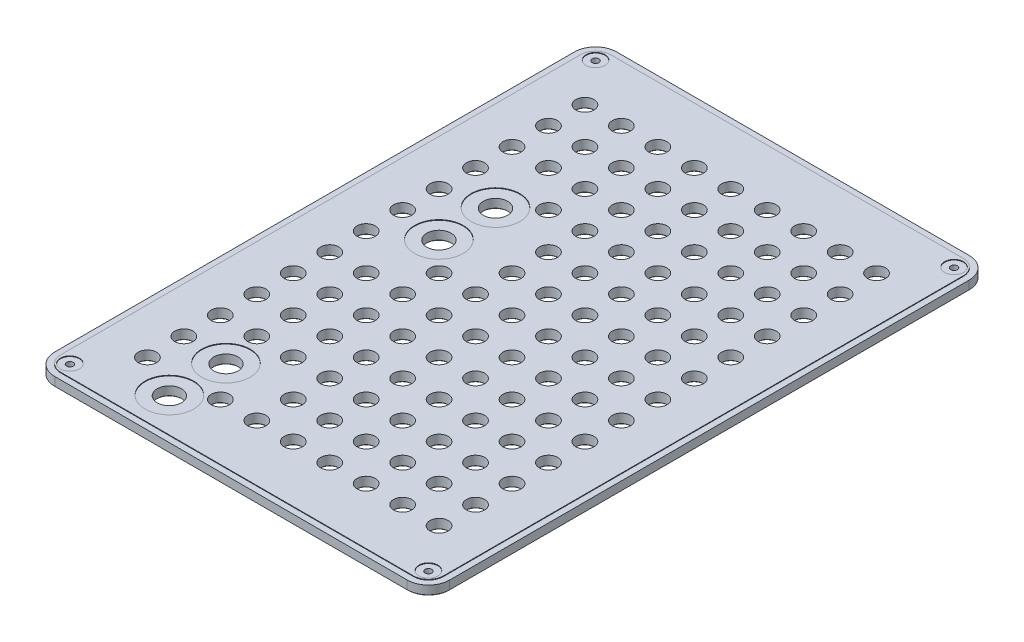
from build123d import *

# Parameters (mm, degrees)
SKETCH_1_W          = 130
SKETCH_1_H          = 185
EXTRUDE_1_DEPTH     = 3
FILLET_1_R          = 7
SKETCH_2_R          = 1.1
CUT_EXTRUDE_1_DEPTH = 3
SKETCH_3_R          = 4
CUT_EXTRUDE_2_DEPTH = 3
SKETCH_5_R          = 8
SKETCH_5_R_2        = 3.1
EXTRUDE_2_DEPTH     = 0.2
SKETCH_4_R          = 3
CUT_EXTRUDE_3_DEPTH = 10
OTHER_1_OUTLINE_R   = 3
OTHER_1_DEPTH       = 3.2
CHAMFER_1_SIZE      = 0.2


# Read off the part's stored shape, not the designer's step: 填充阵列1
with BuildPart() as part:
    # 草图1 → 凸台-拉伸1 (new body)
    with BuildSketch(Plane(origin=(0, 0, 0), x_dir=(1, 0, 0), z_dir=(0, 1, 0))):
        with Locations((65, 92.5)):
            Rectangle(SKETCH_1_W, SKETCH_1_H)
    extrude(amount=EXTRUDE_1_DEPTH)

    # 圆角1
    fillet_1_edges = [part.edges().sort_by_distance(p)[0] for p in [
        (0, 1.5, -185),
        (130, 1.5, -185),
        (130, 1.5, 0),
        (0, 1.5, 0),
    ]]
    fillet(fillet_1_edges, radius=FILLET_1_R)

    # 草图2 → 切除-拉伸1 (cut)
    with BuildSketch(Plane(origin=(0, 3, 0), x_dir=(1, 0, 0), z_dir=(0, 1, 0))):
        with Locations(Location((6, 6, 0), (0, 0, 270))):
            Circle(SKETCH_2_R)
        with Locations(Location((124, 6, 0), (0, 0, 270))):
            Circle(SKETCH_2_R)
        with Locations(Location((124, 179, 0), (0, 0, 270))):
            Circle(SKETCH_2_R)
        with Locations(Location((6, 179, 0), (0, 0, 270))):
            Circle(SKETCH_2_R)
    extrude(amount=-CUT_EXTRUDE_1_DEPTH, mode=Mode.SUBTRACT)

    # 草图3 → 切除-拉伸2 (cut)
    with BuildSketch(Plane(origin=(0, 0, 0), x_dir=(-1, 0, 0), z_dir=(0, -1, 0))):
        with Locations(Location((-31.575736126, 31.770840885, 0), (0, 0, 90))):
            Circle(SKETCH_3_R)
        with Locations(Location((-31.35287608, 13.373728871, 0), (0, 0, 90))):
            Circle(SKETCH_3_R)
        with Locations(Location((-31.575736126, 120.485598314, 0), (0, 0, 90))):
            Circle(SKETCH_3_R)
        with Locations(Location((-31.35287608, 102.0884863, 0), (0, 0, 90))):
            Circle(SKETCH_3_R)
    extrude(amount=-CUT_EXTRUDE_2_DEPTH, mode=Mode.SUBTRACT)

    # 草图5 → 凸台-拉伸2 (add)
    with BuildSketch(Plane(origin=(0, 3, 0), x_dir=(1, 0, 0), z_dir=(0, 1, 0))):
        with BuildLine():
            Line((128, 7), (128, 178))
            ThreePointArc((128, 178), (126.535533906, 181.535533906), (123, 183))
            Line((123, 183), (7, 183))
            ThreePointArc((7, 183), (3.464466094, 181.535533906), (2, 178))
            Line((2, 178), (2, 7))
            ThreePointArc((2, 7), (3.464466094, 3.464466094), (7, 2))
            Line((7, 2), (123, 2))
            ThreePointArc((123, 2), (126.535533906, 3.464466094), (128, 7))
        make_face()
        with Locations(Location((31.575736126, 120.485598314, 0), (0, 0, 270))):
            Circle(SKETCH_5_R, mode=Mode.SUBTRACT)
        with Locations(Location((31.575736126, 31.770840885, 0), (0, 0, 270))):
            Circle(SKETCH_5_R, mode=Mode.SUBTRACT)
        with Locations(Location((31.35287608, 102.0884863, 0), (0, 0, 270))):
            Circle(SKETCH_5_R, mode=Mode.SUBTRACT)
        with Locations(Location((31.35287608, 13.373728871, 0), (0, 0, 270))):
            Circle(SKETCH_5_R, mode=Mode.SUBTRACT)
        with Locations(Location((6, 179, 0), (0, 0, 270))):
            Circle(SKETCH_5_R_2, mode=Mode.SUBTRACT)
        with Locations(Location((124, 179, 0), (0, 0, 270))):
            Circle(SKETCH_5_R_2, mode=Mode.SUBTRACT)
        with Locations(Location((6, 6, 0), (0, 0, 270))):
            Circle(SKETCH_5_R_2, mode=Mode.SUBTRACT)
        with Locations(Location((124, 6, 0), (0, 0, 270))):
            Circle(SKETCH_5_R_2, mode=Mode.SUBTRACT)
    extrude(amount=EXTRUDE_2_DEPTH)

    # 草图4 → 切除-拉伸3 (cut)
    with BuildSketch(Plane(origin=(0, 3.2, 0), x_dir=(1, 0, 0), z_dir=(0, 1, 0))):
        with Locations(Location((65, 92.5, 0), (0, 0, 270))):
            Circle(SKETCH_4_R)
    extrude(amount=-CUT_EXTRUDE_3_DEPTH, mode=Mode.SUBTRACT)

    # 填充阵列1 outline → 填充阵列1 (cut)
    with BuildSketch(Plane(origin=(0, 0, 0), x_dir=(1, 0, 0), z_dir=(0, 1, 0))):
        with Locations((113, 20.5)):
            Circle(OTHER_1_OUTLINE_R)
        with Locations((29, 56.5)):
            Circle(OTHER_1_OUTLINE_R)
        with Locations((29, 44.5)):
            Circle(OTHER_1_OUTLINE_R)
        with Locations((41, 164.5)):
            Circle(OTHER_1_OUTLINE_R)
        with Locations((41, 152.5)):
            Circle(OTHER_1_OUTLINE_R)
        with Locations((41, 140.5)):
            Circle(OTHER_1_OUTLINE_R)
        with Locations((41, 128.5)):
            Circle(OTHER_1_OUTLINE_R)
        with Locations((41, 92.5)):
            Circle(OTHER_1_OUTLINE_R)
        with Locations((41, 80.5)):
            Circle(OTHER_1_OUTLINE_R)
        with Locations((29, 164.5)):
            Circle(OTHER_1_OUTLINE_R)
        with Locations((17, 20.5)):
            Circle(OTHER_1_OUTLINE_R)
        with Locations((17, 32.5)):
            Circle(OTHER_1_OUTLINE_R)
        with Locations((17, 44.5)):
            Circle(OTHER_1_OUTLINE_R)
        with Locations((29, 152.5)):
            Circle(OTHER_1_OUTLINE_R)
        with Locations((29, 140.5)):
            Circle(OTHER_1_OUTLINE_R)
        with Locations((29, 80.5)):
            Circle(OTHER_1_OUTLINE_R)
        with Locations((29, 68.5)):
            Circle(OTHER_1_OUTLINE_R)
        with Locations((53, 32.5)):
            Circle(OTHER_1_OUTLINE_R)
        with Locations((53, 44.5)):
            Circle(OTHER_1_OUTLINE_R)
        with Locations((53, 56.5)):
            Circle(OTHER_1_OUTLINE_R)
        with Locations((53, 68.5)):
            Circle(OTHER_1_OUTLINE_R)
        with Locations((53, 80.5)):
            Circle(OTHER_1_OUTLINE_R)
        with Locations((53, 92.5)):
            Circle(OTHER_1_OUTLINE_R)
        with Locations((53, 104.5)):
            Circle(OTHER_1_OUTLINE_R)
        with Locations((53, 116.5)):
            Circle(OTHER_1_OUTLINE_R)
        with Locations((53, 128.5)):
            Circle(OTHER_1_OUTLINE_R)
        with Locations((53, 140.5)):
            Circle(OTHER_1_OUTLINE_R)
        with Locations((53, 152.5)):
            Circle(OTHER_1_OUTLINE_R)
        with Locations((53, 164.5)):
            Circle(OTHER_1_OUTLINE_R)
        with Locations((41, 20.5)):
            Circle(OTHER_1_OUTLINE_R)
        with Locations((41, 44.5)):
            Circle(OTHER_1_OUTLINE_R)
        with Locations((41, 56.5)):
            Circle(OTHER_1_OUTLINE_R)
        with Locations((41, 68.5)):
            Circle(OTHER_1_OUTLINE_R)
        with Locations((17, 56.5)):
            Circle(OTHER_1_OUTLINE_R)
        with Locations((17, 68.5)):
            Circle(OTHER_1_OUTLINE_R)
        with Locations((17, 80.5)):
            Circle(OTHER_1_OUTLINE_R)
        with Locations((17, 92.5)):
            Circle(OTHER_1_OUTLINE_R)
        with Locations((17, 104.5)):
            Circle(OTHER_1_OUTLINE_R)
        with Locations((17, 116.5)):
            Circle(OTHER_1_OUTLINE_R)
        with Locations((17, 128.5)):
            Circle(OTHER_1_OUTLINE_R)
        with Locations((17, 140.5)):
            Circle(OTHER_1_OUTLINE_R)
        with Locations((17, 152.5)):
            Circle(OTHER_1_OUTLINE_R)
        with Locations((17, 164.5)):
            Circle(OTHER_1_OUTLINE_R)
        with Locations((101, 68.5)):
            Circle(OTHER_1_OUTLINE_R)
        with Locations((101, 80.5)):
            Circle(OTHER_1_OUTLINE_R)
        with Locations((101, 92.5)):
            Circle(OTHER_1_OUTLINE_R)
        with Locations((101, 104.5)):
            Circle(OTHER_1_OUTLINE_R)
        with Locations((101, 116.5)):
            Circle(OTHER_1_OUTLINE_R)
        with Locations((101, 128.5)):
            Circle(OTHER_1_OUTLINE_R)
        with Locations((101, 140.5)):
            Circle(OTHER_1_OUTLINE_R)
        with Locations((101, 152.5)):
            Circle(OTHER_1_OUTLINE_R)
        with Locations((89, 92.5)):
            Circle(OTHER_1_OUTLINE_R)
        with Locations((89, 80.5)):
            Circle(OTHER_1_OUTLINE_R)
        with Locations((89, 68.5)):
            Circle(OTHER_1_OUTLINE_R)
        with Locations((89, 56.5)):
            Circle(OTHER_1_OUTLINE_R)
        with Locations((101, 164.5)):
            Circle(OTHER_1_OUTLINE_R)
        with Locations((89, 20.5)):
            Circle(OTHER_1_OUTLINE_R)
        with Locations((89, 32.5)):
            Circle(OTHER_1_OUTLINE_R)
        with Locations((89, 44.5)):
            Circle(OTHER_1_OUTLINE_R)
        with Locations((113, 32.5)):
            Circle(OTHER_1_OUTLINE_R)
        with Locations((113, 44.5)):
            Circle(OTHER_1_OUTLINE_R)
        with Locations((113, 56.5)):
            Circle(OTHER_1_OUTLINE_R)
        with Locations((113, 68.5)):
            Circle(OTHER_1_OUTLINE_R)
        with Locations((113, 80.5)):
            Circle(OTHER_1_OUTLINE_R)
        with Locations((113, 92.5)):
            Circle(OTHER_1_OUTLINE_R)
        with Locations((113, 104.5)):
            Circle(OTHER_1_OUTLINE_R)
        with Locations((113, 116.5)):
            Circle(OTHER_1_OUTLINE_R)
        with Locations((113, 128.5)):
            Circle(OTHER_1_OUTLINE_R)
        with Locations((113, 140.5)):
            Circle(OTHER_1_OUTLINE_R)
        with Locations((113, 152.5)):
            Circle(OTHER_1_OUTLINE_R)
        with Locations((113, 164.5)):
            Circle(OTHER_1_OUTLINE_R)
        with Locations((101, 20.5)):
            Circle(OTHER_1_OUTLINE_R)
        with Locations((101, 32.5)):
            Circle(OTHER_1_OUTLINE_R)
        with Locations((101, 44.5)):
            Circle(OTHER_1_OUTLINE_R)
        with Locations((101, 56.5)):
            Circle(OTHER_1_OUTLINE_R)
        with Locations((65, 68.5)):
            Circle(OTHER_1_OUTLINE_R)
        with Locations((65, 56.5)):
            Circle(OTHER_1_OUTLINE_R)
        with Locations((65, 44.5)):
            Circle(OTHER_1_OUTLINE_R)
        with Locations((65, 32.5)):
            Circle(OTHER_1_OUTLINE_R)
        with Locations((77, 140.5)):
            Circle(OTHER_1_OUTLINE_R)
        with Locations((77, 152.5)):
            Circle(OTHER_1_OUTLINE_R)
        with Locations((77, 164.5)):
            Circle(OTHER_1_OUTLINE_R)
        with Locations((65, 20.5)):
            Circle(OTHER_1_OUTLINE_R)
        with Locations((65, 140.5)):
            Circle(OTHER_1_OUTLINE_R)
        with Locations((65, 152.5)):
            Circle(OTHER_1_OUTLINE_R)
        with Locations((65, 164.5)):
            Circle(OTHER_1_OUTLINE_R)
        with Locations((53, 20.5)):
            Circle(OTHER_1_OUTLINE_R)
        with Locations((65, 128.5)):
            Circle(OTHER_1_OUTLINE_R)
        with Locations((65, 116.5)):
            Circle(OTHER_1_OUTLINE_R)
        with Locations((65, 104.5)):
            Circle(OTHER_1_OUTLINE_R)
        with Locations((65, 80.5)):
            Circle(OTHER_1_OUTLINE_R)
        with Locations((77, 32.5)):
            Circle(OTHER_1_OUTLINE_R)
        with Locations((77, 20.5)):
            Circle(OTHER_1_OUTLINE_R)
        with Locations((89, 164.5)):
            Circle(OTHER_1_OUTLINE_R)
        with Locations((89, 152.5)):
            Circle(OTHER_1_OUTLINE_R)
        with Locations((89, 140.5)):
            Circle(OTHER_1_OUTLINE_R)
        with Locations((89, 128.5)):
            Circle(OTHER_1_OUTLINE_R)
        with Locations((89, 116.5)):
            Circle(OTHER_1_OUTLINE_R)
        with Locations((89, 104.5)):
            Circle(OTHER_1_OUTLINE_R)
        with Locations((77, 44.5)):
            Circle(OTHER_1_OUTLINE_R)
        with Locations((77, 56.5)):
            Circle(OTHER_1_OUTLINE_R)
        with Locations((77, 68.5)):
            Circle(OTHER_1_OUTLINE_R)
        with Locations((77, 80.5)):
            Circle(OTHER_1_OUTLINE_R)
        with Locations((77, 92.5)):
            Circle(OTHER_1_OUTLINE_R)
        with Locations((77, 104.5)):
            Circle(OTHER_1_OUTLINE_R)
        with Locations((77, 116.5)):
            Circle(OTHER_1_OUTLINE_R)
        with Locations((77, 128.5)):
            Circle(OTHER_1_OUTLINE_R)
    extrude(amount=OTHER_1_DEPTH, mode=Mode.SUBTRACT)

    # 倒角1
    chamfer_1_edges = [part.edges().sort_by_distance(p)[0] for p in [
        (65, 0, -95.5),
        (65, 0, -185),
        (0, 0, -92.5),
        (130, 0, -92.5),
        (65, 0, 0),
        (127.949747468, 0, -2.050252532),
        (2.050252532, 0, -2.050252532),
        (2.050252532, 0, -182.949747468),
        (127.949747468, 0, -182.949747468),
        (74, 0, -128.5),
        (74, 0, -116.5),
        (74, 0, -104.5),
        (74, 0, -92.5),
        (74, 0, -80.5),
        (74, 0, -68.5),
        (74, 0, -56.5),
        (74, 0, -44.5),
        (86, 0, -104.5),
        (86, 0, -116.5),
        (86, 0, -128.5),
        (86, 0, -140.5),
        (86, 0, -152.5),
        (86, 0, -164.5),
        (74, 0, -20.5),
        (74, 0, -32.5),
        (62, 0, -80.5),
        (62, 0, -104.5),
        (62, 0, -116.5),
        (62, 0, -128.5),
        (50, 0, -20.5),
        (62, 0, -164.5),
        (62, 0, -152.5),
        (62, 0, -140.5),
        (62, 0, -20.5),
        (74, 0, -164.5),
        (74, 0, -152.5),
        (74, 0, -140.5),
        (62, 0, -32.5),
        (62, 0, -44.5),
        (62, 0, -56.5),
        (62, 0, -68.5),
        (98, 0, -56.5),
        (98, 0, -44.5),
        (98, 0, -32.5),
        (98, 0, -20.5),
        (110, 0, -164.5),
        (110, 0, -152.5),
        (110, 0, -140.5),
        (110, 0, -128.5),
        (110, 0, -116.5),
        (110, 0, -104.5),
        (110, 0, -92.5),
        (110, 0, -80.5),
        (110, 0, -68.5),
        (110, 0, -56.5),
        (110, 0, -44.5),
        (110, 0, -32.5),
        (86, 0, -44.5),
        (86, 0, -32.5),
        (86, 0, -20.5),
        (98, 0, -164.5),
        (86, 0, -56.5),
        (86, 0, -68.5),
        (86, 0, -80.5),
        (86, 0, -92.5),
        (98, 0, -152.5),
        (98, 0, -140.5),
        (98, 0, -128.5),
        (98, 0, -116.5),
        (98, 0, -104.5),
        (98, 0, -92.5),
        (98, 0, -80.5),
        (98, 0, -68.5),
        (14, 0, -164.5),
        (6, 0, -180.1),
        (14, 0, -152.5),
        (14, 0, -140.5),
        (14, 0, -128.5),
        (14, 0, -116.5),
        (14, 0, -104.5),
        (14, 0, -92.5),
        (124, 0, -180.1),
        (14, 0, -80.5),
        (14, 0, -68.5),
        (14, 0, -56.5),
        (38, 0, -68.5),
        (38, 0, -56.5),
        (124, 0, -7.1),
        (38, 0, -44.5),
        (38, 0, -20.5),
        (50, 0, -164.5),
        (50, 0, -152.5),
        (50, 0, -140.5),
        (50, 0, -128.5),
        (6, 0, -7.1),
        (50, 0, -116.5),
        (50, 0, -104.5),
        (50, 0, -92.5),
        (50, 0, -80.5),
        (50, 0, -68.5),
        (50, 0, -56.5),
        (50, 0, -44.5),
        (50, 0, -32.5),
        (26, 0, -68.5),
        (26, 0, -80.5),
        (26, 0, -140.5),
        (26, 0, -152.5),
        (14, 0, -44.5),
        (14, 0, -32.5),
        (14, 0, -20.5),
        (26, 0, -164.5),
        (38, 0, -80.5),
        (38, 0, -92.5),
        (38, 0, -128.5),
        (38, 0, -140.5),
        (38, 0, -152.5),
        (38, 0, -164.5),
        (26, 0, -44.5),
        (26, 0, -56.5),
        (110, 0, -20.5),
        (31.35287608, 0, -9.373728871),
        (31.575736126, 0, -116.485598314),
        (31.35287608, 0, -98.0884863),
        (31.575736126, 0, -27.770840885),
    ]]
    chamfer(chamfer_1_edges, length=CHAMFER_1_SIZE)


solid = part.part
